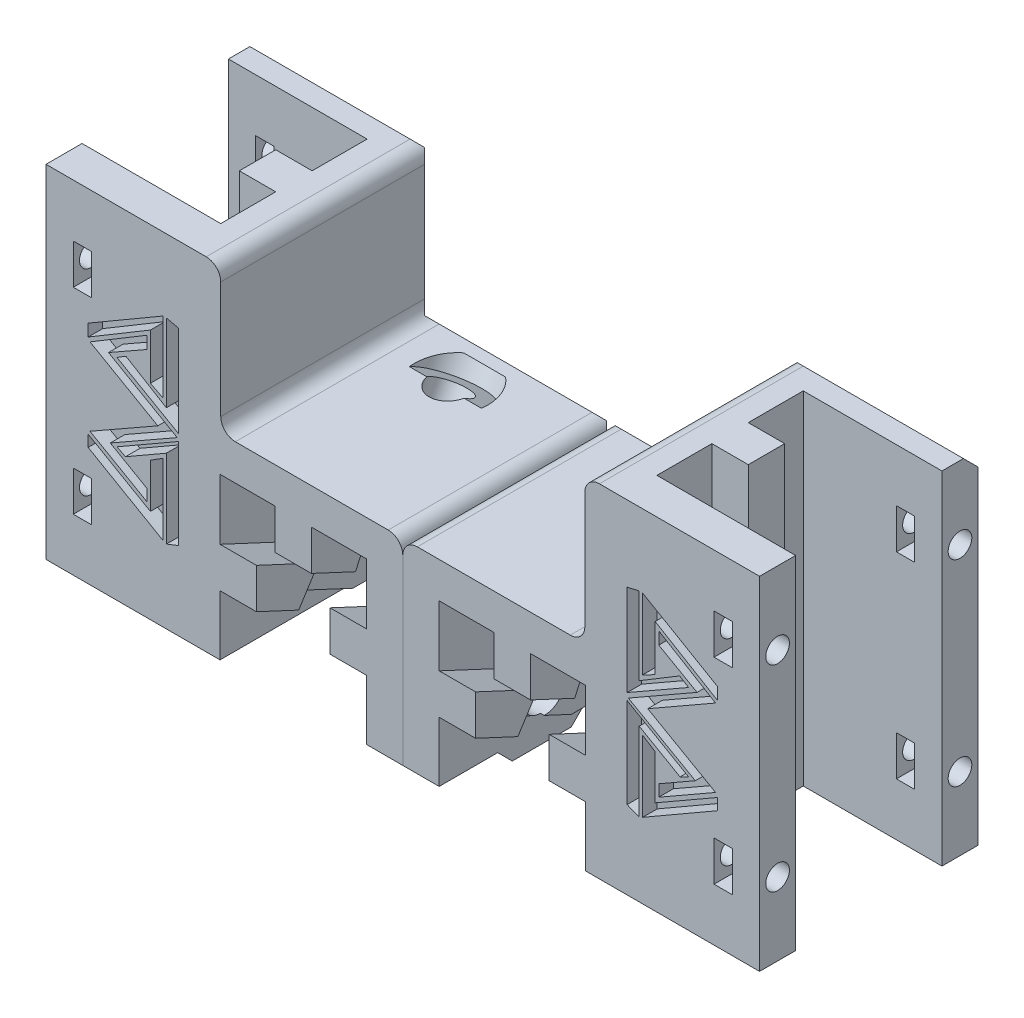
from build123d import *

# Parameters (mm, degrees)
SKETCH1_W                       = 30
SKETCH1_H                       = 30
BOSS_EXTRUDE1_DEPTH             = 50
CUT_EXTRUDE1_DEPTH              = 55.313902456
SKETCH3_W                       = 6
SKETCH3_H                       = 30
CUT_EXTRUDE2_DEPTH              = 55.313902456
SKETCH5_W                       = 30
SKETCH5_H                       = 30
BOSS_EXTRUDE2_DEPTH             = 25
F_45_DEGREE_EXTRUSION_CUT_DEPTH = 73.926037689
SKETCH11_R                      = 1.625
CUT_EXTRUDE7_DEPTH              = 10
CHAMFER1_SIZE                   = 2
FILLET1_R                       = 2
SKETCH16_R                      = 2.675
CUT_EXTRUDE10_DEPTH             = 10
CUT_EXTRUDE11_DEPTH             = 9.5
FILLET2_R                       = 0.5
FILLET3_R                       = 0.5
SKETCH19_W                      = 49
SKETCH19_H                      = 3
CUT_EXTRUDE12_DEPTH             = 71.710678119
SKETCH20_W                      = 6.753728314
SKETCH20_H                      = 6.253099935
CUT_EXTRUDE13_DEPTH             = 15
SKETCH22_R                      = 2.65
CUT_EXTRUDE14_DEPTH             = 51.035604398
SKETCH23_R                      = 5
CUT_EXTRUDE15_DEPTH             = 2.5
SKETCH24_W                      = 5
SKETCH24_H                      = 15
CUT_EXTRUDE16_DEPTH             = 4
SKETCH25_W                      = 5
SKETCH25_H                      = 12.094379765
BOSS_EXTRUDE3_DEPTH             = 2
CHAMFER2_SIZE                   = 2
SKETCH26_W                      = 2.5
SKETCH26_H                      = 5.5
CUT_EXTRUDE17_DEPTH             = 71.710678119
FILLET4_R                       = 0.5
CUT_EXTRUDE18_DEPTH             = 2


with BuildPart() as part:
    # Sketch1 → Boss-Extrude1 (new body)
    with BuildSketch(Plane(origin=(0, 0, 0), x_dir=(1, 0, 0), z_dir=(0, 1, 0))):
        Rectangle(SKETCH1_W, SKETCH1_H)
    extrude(amount=BOSS_EXTRUDE1_DEPTH)

    # Sketch2 → Cut-Extrude1 (cut, through all)
    with BuildSketch(Plane(origin=(0, 50, 0), x_dir=(1, 0, 0), z_dir=(0, 1, 0))):
        Polygon((-10.05, -2.5), (-10.05, -10.05), (10.05, -10.05), (10.05, 10.05), (-10.05, 10.05), (-10.05, 2.5), (-5.05, 2.5), (-5.05, -2.5), align=None)
    extrude(amount=-CUT_EXTRUDE1_DEPTH, mode=Mode.SUBTRACT)

    # Sketch3 → Cut-Extrude2 (cut, through all)
    with BuildSketch(Plane(origin=(0, 50, 0), x_dir=(1, 0, 0), z_dir=(0, 1, 0))):
        with Locations((12, 0)):
            Rectangle(SKETCH3_W, SKETCH3_H)
    extrude(amount=-CUT_EXTRUDE2_DEPTH, mode=Mode.SUBTRACT)

    # Sketch5 → Boss-Extrude2 (add)
    with BuildSketch(Plane.ZY.offset(15)):
        with Locations((0, 15)):
            Rectangle(SKETCH5_W, SKETCH5_H)
    extrude(amount=BOSS_EXTRUDE2_DEPTH)

    # Sketch7 → 45 degree extrusion cut (cut, through all)
    with BuildSketch(Plane(origin=(-40, 12.069825676, -23.451382923), x_dir=(-1, 0, 0), z_dir=(0, -0.42261826174069717, -0.9063077870366509))):
        Polygon((-25.1, -17.010685759), (-25.1, -24.560685759), (-17.55, -24.560685759), (-17.55, -19.560685759), (-12.55, -19.560685759), (-12.55, -24.560685759), (-5, -24.560685759), (-5, -17.010685759), (-10, -17.010685759), (-10, -14.510685759), (-20.1, -14.510685759), (-20.1, -17.010685759), align=None)
        Polygon((-25.1, -4.460685759), (-25.1, -12.010685759), (-20.1, -12.010685759), (-20.1, -14.510685759), (-10, -14.510685759), (-10, -12.010685759), (-5, -12.010685759), (-5, -4.460685759), (-12.55, -4.460685759), (-12.55, -9.460685759), (-17.55, -9.460685759), (-17.55, -4.460685759), align=None)
    extrude(amount=-F_45_DEGREE_EXTRUSION_CUT_DEPTH, mode=Mode.SUBTRACT)

    # Sketch11 → Cut-Extrude7 (cut)
    with BuildSketch(Plane(origin=(9, 0, 0), x_dir=(0, 0, -1), z_dir=(1, 0, 0))):
        with Locations((-12.525, 40)):
            Circle(SKETCH11_R)
        with Locations((12.525, 40)):
            Circle(SKETCH11_R)
        with Locations((12.525, 13)):
            Circle(SKETCH11_R)
        with Locations((-12.525, 13)):
            Circle(SKETCH11_R)
    extrude(amount=-CUT_EXTRUDE7_DEPTH, mode=Mode.SUBTRACT)

    # Chamfer1
    chamfer1_edges = [part.edges().sort_by_distance(p)[0] for p in [
        (-5.45, 0, -15),
        (-3, 50, -15),
        (-27.5, 30, -15),
        (-40, 15, -15),
        (-15, 40, -15),
        (-35, 0, -15),
    ]]
    chamfer(chamfer1_edges, length=CHAMFER1_SIZE)

    # Fillet1
    fillet1_edges = [part.edges().sort_by_distance(p)[0] for p in [
        (-15, 50, 1),
        (-15, 30, 1),
        (-40, 30, 1),
        (-40, 0, 1),
    ]]
    fillet(fillet1_edges, radius=FILLET1_R)

    # Sketch16 → Cut-Extrude10 (cut)
    with BuildSketch(Plane.ZY.offset(40)):
        with Locations((1, 7.415122828)):
            Circle(SKETCH16_R)
    extrude(amount=-CUT_EXTRUDE10_DEPTH, mode=Mode.SUBTRACT)

    # Sketch18 → Cut-Extrude11 (cut, symmetric)
    with BuildSketch(Plane.ZY.offset(25)):
        Polygon((9.950685103, 7.347750191), (5.606439218, 14.127716409), (-7.950685103, 7.482495466), (-3.606439218, 0.702529248), align=None)
    extrude(amount=CUT_EXTRUDE11_DEPTH, both=True, mode=Mode.SUBTRACT)

    # Fillet2
    fillet2_edges = [part.edges().sort_by_distance(p)[0] for p in [
        (-24.95, 0, -3.050682005),
    ]]
    fillet(fillet2_edges, radius=FILLET2_R)

    # Fillet3
    fillet3_edges = [part.edges().sort_by_distance(p)[0] for p in [
        (-24.95, 8.417171254, 15),
    ]]
    fillet(fillet3_edges, radius=FILLET3_R)

    # Sketch19 → Cut-Extrude12 (cut, through all)
    with BuildSketch(Plane.XY.offset(15)):
        with Locations((-15.5, 1.5)):
            Rectangle(SKETCH19_W, SKETCH19_H)
    extrude(amount=-CUT_EXTRUDE12_DEPTH, mode=Mode.SUBTRACT)


with BuildPart() as cut_extrude12_piece_1:
    # of the separate pieces the step leaves, piece 1, a body of its own (cut_extrude12_pieces)
    add(part.part.solids().sort_by_distance((-14.9, 3, 15))[0])

    # Sketch22 → Cut-Extrude14 (cut, through all)
    with BuildSketch(Plane(origin=(-25, 31.908299393, -7.624586929), x_dir=(1, 0, 0), z_dir=(3.142436568436473e-15, 0.8851034809979968, -0.46539427147874146))):
        with Locations(Location((0.022023463, 0.014340274, 0), (0, 0, 201.118214674))):
            Circle(SKETCH22_R)
    extrude(amount=-CUT_EXTRUDE14_DEPTH, mode=Mode.SUBTRACT)

    # Sketch23 → Cut-Extrude15 (cut)
    with BuildSketch(Plane(origin=(-25, 31.908299393, -7.624586929), x_dir=(1, 0, 0), z_dir=(3.142436568436473e-15, 0.8851034809979968, -0.46539427147874146))):
        with Locations((0.022023463, 0.014340274)):
            Circle(SKETCH23_R)
    extrude(amount=-CUT_EXTRUDE15_DEPTH, mode=Mode.SUBTRACT)

    # Sketch24 → Cut-Extrude16 (cut)
    with BuildSketch(Plane(origin=(0, 10.322187648, -4.813315149), x_dir=(1, 0, 0), z_dir=(0, -0.906307787036651, 0.4226182617406971))):
        with Locations((-24.95, 7.684747226)):
            Rectangle(SKETCH24_W, SKETCH24_H)
    extrude(amount=-CUT_EXTRUDE16_DEPTH, mode=Mode.SUBTRACT)

    # Sketch25 → Boss-Extrude3 (add)
    with BuildSketch(Plane.XZ.offset(-3)):
        with Locations((-37.5, 0.91772931)):
            Rectangle(SKETCH25_W, SKETCH25_H)
    extrude(amount=BOSS_EXTRUDE3_DEPTH)

    # Chamfer2
    chamfer2_edges = [cut_extrude12_piece_1.edges().sort_by_distance(p)[0] for p in [
        (-37.5, 1, -5.129460572),
        (-37.5, 1, 6.964919193),
    ]]
    chamfer(chamfer2_edges, length=CHAMFER2_SIZE - 0.0001)  # a hair under: the kernel refuses the full size

    # Sketch26 → Cut-Extrude17 (cut, through all)
    with BuildSketch(Plane.XY.offset(15)):
        with Locations((4, 40)):
            Rectangle(SKETCH26_W, SKETCH26_H)
        with Locations((4, 13)):
            Rectangle(SKETCH26_W, SKETCH26_H)
    extrude(amount=-CUT_EXTRUDE17_DEPTH, mode=Mode.SUBTRACT)

    # Fillet4
    fillet4_edges = [cut_extrude12_piece_1.edges().sort_by_distance(p)[0] for p in [
        (-32.5, 3, -14.481983196),
        (-24.95, 5.572058491, -15),
        (-17.4, 3, -14.481983196),
    ]]
    fillet(fillet4_edges, radius=FILLET4_R)

    # Mobious Logo → Cut-Extrude18 (cut)
    with BuildSketch(Plane(origin=(0, 0, 15), x_dir=(-1, 0, 0), z_dir=(0, 0, 1))):
        Polygon((-3.210868628, -32.348650408), (-3.210868628, -34.003716414), (7.056151005, -39.978785217), (7.056151005, -30.244752942), (5.33825141, -31.122174097), (5.33825141, -37.454108258), align=None)
        Polygon((1.978745121, -32.657222036), (0.744458608, -31.899818949), (9.188100437, -27.07488076), (9.188100437, -39.614109657), (7.533034431, -39.985072727), (7.533034431, -29.307901849), align=None)
        Polygon((4.840045674, -36.584497306), (-2.958400932, -31.899818949), (6.355467669, -26.569945368), (-2.958400932, -21.268123754), (4.840045674, -16.805452407), (4.840045674, -18.400245934), (-0.171524822, -21.268123754), (9.019468658, -26.5), (-0.416628352, -31.899818949), (4.840045674, -34.892125279), align=None)
        Polygon((-3.210868628, -20.791240329), (-3.210868628, -19.220330221), (7.056151005, -13.30136535), (7.056151005, -23.063449592), (5.33825141, -21.96942291), (5.33825141, -15.882146242), align=None)
        Polygon((0.744458608, -21.268123754), (9.188100437, -26.121113909), (9.188100437, -13.75019681), (7.533034431, -13.093877531), (7.533034431, -23.905008578), (1.915732347, -20.67645954), align=None)
    extrude(amount=-CUT_EXTRUDE18_DEPTH, mode=Mode.SUBTRACT)


with BuildPart() as cut_extrude12_piece_2:
    # of the separate pieces the step leaves, piece 2, a body of its own (cut_extrude12_pieces)
    add(part.part.solids().sort_by_distance((-27.45, 3, 15))[0])

    # Sketch20 → Cut-Extrude13 (cut)
    with BuildSketch(Plane.XY.offset(15)):
        with Locations((-25.201643275, 5.301831254)):
            Rectangle(SKETCH20_W, SKETCH20_H)
    extrude(amount=-CUT_EXTRUDE13_DEPTH, mode=Mode.SUBTRACT)


with BuildPart() as body_2:
    # Mirror1: mirrored copy
    add(cut_extrude12_piece_1.part.mirror(Plane.ZY.offset(40)))


solid = Compound([cut_extrude12_piece_1.part, body_2.part])
